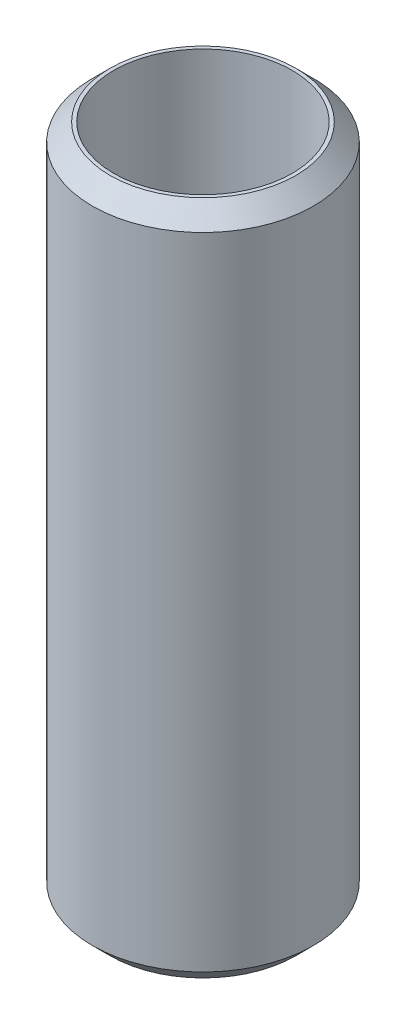
from build123d import *

# Parameters (mm, degrees)
SKETCH1_R           = 32.5
BOSS_EXTRUDE1_DEPTH = 198.631097981
SKETCH2_R           = 26.240816551
CUT_EXTRUDE1_DEPTH  = 204.879408193
CHAMFER1_SIZE       = 5.192721223


with BuildPart() as part:
    # Sketch1 → Boss-Extrude1 (new body)
    with BuildSketch(Plane(origin=(0, 0, 0), x_dir=(1, 0, 0), z_dir=(0, 1, 0))):
        Circle(SKETCH1_R)
    extrude(amount=BOSS_EXTRUDE1_DEPTH)

    # Sketch2 → Cut-Extrude1 (cut, through all)
    with BuildSketch(Plane(origin=(0, 0, 0), x_dir=(1, 0, 0), z_dir=(0, 1, 0))):
        Circle(SKETCH2_R)
    extrude(amount=CUT_EXTRUDE1_DEPTH, mode=Mode.SUBTRACT)

    # Chamfer1
    chamfer1_edges = [part.edges().sort_by_distance(p)[0] for p in [
        (-32.5, 198.631097981, 0),
        (-32.5, 0, 0),
    ]]
    chamfer(chamfer1_edges, length=CHAMFER1_SIZE)


solid = part.part
